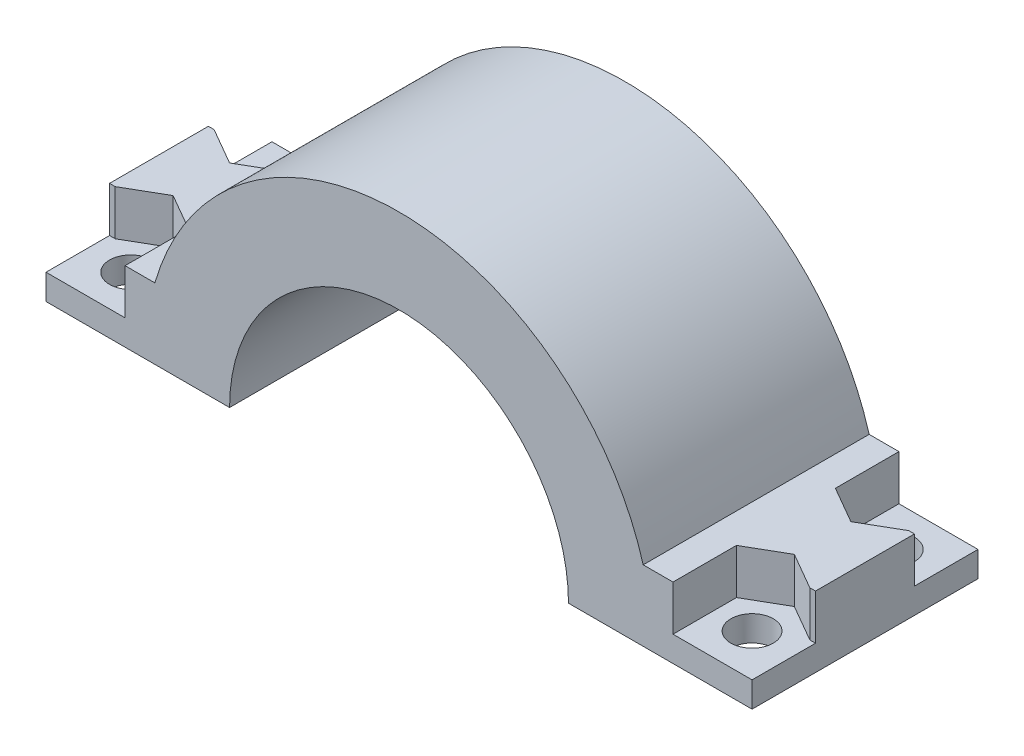
from build123d import *
from OCP.BRepAlgoAPI import BRepAlgoAPI_Cut
from OCP.TopTools import TopTools_ListOfShape

# Parameters (mm, degrees)
BOSS_EXTRUDE1_DEPTH = 16
CUT_EXTRUDE12_START = -22.166013
CUT_EXTRUDE12_DEPTH = 3.2
SKETCH14_R          = 1.5
CUT_EXTRUDE13_DEPTH = 50


with BuildPart() as part:
    # Sketch7 → Boss-Extrude1 (new body)
    with BuildSketch(Plane.XY):
        with BuildLine():
            Line((28.868798372, -27.16601268), (28.868798372, -22.16601268))
            Line((28.868798372, -22.16601268), (21.160414837, -22.16601268))
            ThreePointArc((21.160414837, -22.16601268), (3.868798372, -9.16601268), (-13.422818094, -22.16601268))
            Line((-13.422818094, -22.16601268), (-21.131201628, -22.16601268))
            Line((-21.131201628, -22.16601268), (-21.131201628, -27.16601268))
            Line((-21.131201628, -27.16601268), (-8.131201628, -27.16601268))
            ThreePointArc((-8.131201628, -27.16601268), (3.868798372, -15.16601268), (15.868798372, -27.16601268))
            Line((15.868798372, -27.16601268), (28.868798372, -27.16601268))
        make_face()
    extrude(amount=BOSS_EXTRUDE1_DEPTH)


with BuildPart() as cut_extrude12_tool:
    # Sketch13 → Cut-Extrude12 (new body)
    with BuildSketch(Plane(origin=(0, 0, 0), x_dir=(1, 0, 0), z_dir=(0, 1, 0)).offset(CUT_EXTRUDE12_START)):
        Polygon((-15.533125417, -4.5), (-15.533125417, -1.5), (-15.533125417, 0), (-18.131201628, 0), (-20.72927784, 0), (-21.131201628, 0), (-21.131201628, -4.5), (-20.72927784, -4.5), (-18.131201628, -6), align=None)
        Polygon((-21.131201628, -11.5), (-20.72927784, -11.5), (-18.131201628, -10), (-15.533125417, -11.5), (-15.533125417, -11.544775658), (-15.533125417, -16), (-18.131201628, -16), (-20.72927784, -16), (-21.131201628, -16), align=None)
        Polygon((23.27072216, -4.5), (23.27072216, -1.5), (23.27072216, 0), (25.868798372, 0), (28.466874583, 0), (28.868798372, 0), (28.868798372, -4.5), (28.466874583, -4.5), (25.868798372, -6), align=None)
        Polygon((28.466874583, -11.506491479), (25.868798372, -10.006491479), (23.27072216, -11.506491479), (23.27072216, -14.506491479), (23.27072216, -16.006491479), (25.868798372, -16.006491479), (28.466874583, -16.006491479), (28.868798372, -16.006491479), (28.868798372, -11.506491479), align=None)
    extrude(amount=-CUT_EXTRUDE12_DEPTH)


with BuildPart() as part_1:
    add(part.part)

    # Cut-Extrude12: cut by cut_extrude12_tool, with a tolerance
    cut_extrude12_stock = TopTools_ListOfShape()
    cut_extrude12_stock.Append(part_1.part.wrapped)
    cut_extrude12_tools = TopTools_ListOfShape()
    cut_extrude12_tools.Append(cut_extrude12_tool.part.wrapped)
    cut_extrude12_cut = BRepAlgoAPI_Cut()
    cut_extrude12_cut.SetArguments(cut_extrude12_stock)
    cut_extrude12_cut.SetTools(cut_extrude12_tools)
    cut_extrude12_cut.SetFuzzyValue(0.00001)
    cut_extrude12_cut.Build()
    add(Compound.cast(cut_extrude12_cut.Shape()).solids(), mode=Mode.REPLACE)

    # Sketch14 → Cut-Extrude13 (cut)
    with BuildSketch(Plane(origin=(0, 0, 0), x_dir=(1, 0, 0), z_dir=(0, 1, 0))):
        with Locations(Location((-18.131201628, -3, 0), (0, 0, 270))):
            Circle(SKETCH14_R)
        with Locations(Location((-18.131201628, -13, 0), (0, 0, 270))):
            Circle(SKETCH14_R)
        with Locations(Location((25.868798372, -3, 0), (0, 0, 270))):
            Circle(SKETCH14_R)
        with Locations(Location((25.868798372, -13, 0), (0, 0, 270))):
            Circle(SKETCH14_R)
    extrude(amount=-CUT_EXTRUDE13_DEPTH, mode=Mode.SUBTRACT)


solid = part_1.part
